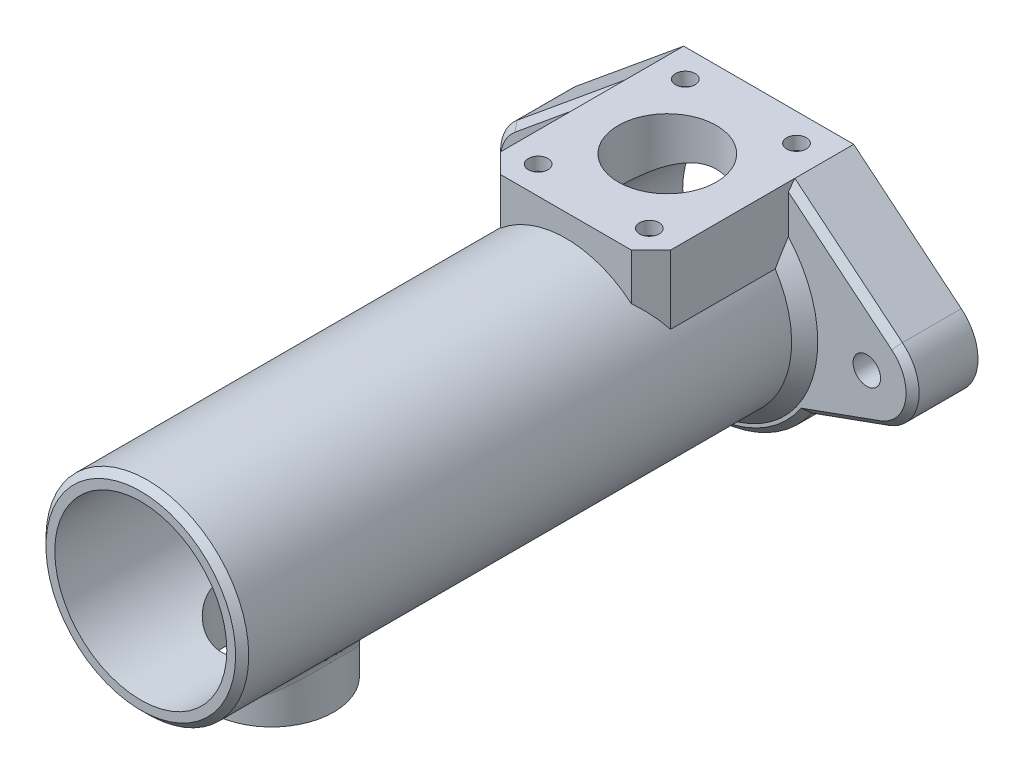
from build123d import *

# Parameters (mm, degrees)
SKIZZE1_R                       = 13.15
GRUNDK_RPER_DEPTH               = 96
SKIZZE11_R                      = 2.1
SKIZZE11_R_2                    = 13.15
AUFSATZ_LINEAR_AUSTRAGEN1_DEPTH = 10
FLANSCHTRICHTER_START           = -65
FLANSCHTRICHTER_DEPTH           = 65
SKIZZE7_R                       = 7.5
FUTTERAUSGANG_DEPTH             = 103.961157725
FUTTERAUSGANGROHR_REACH         = 110.427
FUTTERAUSGANGROHR_END_RADIUS    = 15.5
SKIZZE8_R                       = 9.5
SKIZZE8_R_2                     = 7.5
SKIZZE9_R                       = 7.5
SKIZZE9_R_2                     = 1.5
SCHRAUBENBOHRUNGEN_DEPTH        = 4
BOHRUNG_15MM_REACH              = 109.055
SKIZZE15_R                      = 7.5
BOHRUNG_15MM_DIRECTION_2_DEPTH  = 108.055460001
MUTTER_DEPTH                    = 2
FASE1_SIZE                      = 3
FASE2_SIZE                      = 2
VERRUNDUNG1_R                   = 2
FASE3_SIZE                      = 1
FASE4_SIZE                      = 1


with BuildPart() as part:
    # Skizze1 → Grundkörper (new body)
    with BuildSketch(Plane.XY):
        with BuildLine():
            Line((-13, 8.440971508), (-13, 18.940971508))
            Line((-13, 18.940971508), (13, 18.940971508))
            Line((13, 18.940971508), (13, 8.440971508))
            ThreePointArc((13, 8.440971508), (0, -15.5), (-13, 8.440971508))
        make_face()
        Circle(SKIZZE1_R, mode=Mode.SUBTRACT)
    extrude(amount=GRUNDK_RPER_DEPTH)

    # Skizze11 → Aufsatz-Linear austragen1 (add)
    with BuildSketch(Plane(origin=(0, 0, 0), x_dir=(-1, 0, 0), z_dir=(0, 0, -1))):
        with BuildLine():
            Line((13, 18.940971508), (29.448078949, 5.405052605))
            ThreePointArc((29.448078949, 5.405052605), (31.898107369, -1.190006186), (27.38, -6.582978049))
            Line((27.38, -6.582978049), (15.603987614, -10.840459887))
            ThreePointArc((15.603987614, -10.840459887), (0, -19), (-15.603987614, -10.840459887))
            Line((-15.603987614, -10.840459887), (-27.38, -6.582978049))
            ThreePointArc((-27.38, -6.582978049), (-31.898107369, -1.190006186), (-29.448078949, 5.405052605))
            Line((-29.448078949, 5.405052605), (-13, 18.940971508))
            Line((-13, 18.940971508), (13, 18.940971508))
        make_face()
        with Locations((25, 0)):
            Circle(SKIZZE11_R, mode=Mode.SUBTRACT)
        with Locations(Location((0, 0, 0), (0, 0, 180))):
            Circle(SKIZZE11_R_2, mode=Mode.SUBTRACT)
        with Locations((-25, 0)):
            Circle(SKIZZE11_R, mode=Mode.SUBTRACT)
    extrude(amount=-AUFSATZ_LINEAR_AUSTRAGEN1_DEPTH)

    # Skizze2 → FlanschTrichter (cut)
    with BuildSketch(Plane.XY.offset(96).offset(FLANSCHTRICHTER_START)):
        with BuildLine():
            Line((-13, 18.940971508), (13, 18.940971508))
            Line((13, 18.940971508), (13, 8.440971508))
            ThreePointArc((13, 8.440971508), (0, 15.5), (-13, 8.440971508))
            Line((-13, 8.440971508), (-13, 18.940971508))
        make_face()
    extrude(amount=FLANSCHTRICHTER_DEPTH, mode=Mode.SUBTRACT)

    # Skizze7 → FutterAusgang (cut, through all)
    with BuildSketch(Plane(origin=(0, 0, 0), x_dir=(1, 0, 0), z_dir=(0, 1, 0))):
        with Locations(Location((0, -76, 0), (0, 0, 270))):
            Circle(SKIZZE7_R)
    extrude(amount=-FUTTERAUSGANG_DEPTH, mode=Mode.SUBTRACT)

    # FutterAusgangRohr: up to this cylinder (the profile starts outside it)
    futterausgangrohr_end = Plane(origin=(0, 0, 85.231299), z_dir=(0, 0, -1)) * Cylinder(FUTTERAUSGANGROHR_END_RADIUS, 252.854, mode=Mode.PRIVATE)
    # Skizze8 → FutterAusgangRohr (add, up to the surface)
    with BuildSketch(Plane(origin=(0, -20, 0), x_dir=(1, 0, 0), z_dir=(0, 1, 0)), mode=Mode.PRIVATE) as futterausgangrohr_sk1:
        with Locations(Location((0, -76, 0), (0, 0, 90))):
            Circle(SKIZZE8_R)
        with Locations(Location((0, -76, 0), (0, 0, 270))):
            Circle(SKIZZE8_R_2, mode=Mode.SUBTRACT)
    futterausgangrohr_tool1 = extrude(futterausgangrohr_sk1.sketch, amount=FUTTERAUSGANGROHR_REACH, mode=Mode.PRIVATE) - futterausgangrohr_end
    add(futterausgangrohr_tool1.solids().sort_by_distance((0, -20, 85.231299))[0])

    # Skizze9 → Schraubenbohrungen (cut)
    with BuildSketch(Plane(origin=(0, 18.940971508, 0), x_dir=(1, 0, 0), z_dir=(0, 1, 0))):
        with Locations(Location((0, -15.5, 0), (0, 0, 270))):
            Circle(SKIZZE9_R)
        with Locations(Location((8.5, -4.25, 0), (0, 0, 270))):
            Circle(SKIZZE9_R_2)
        with Locations(Location((8.5, -26.75, 0), (0, 0, 270))):
            Circle(SKIZZE9_R_2)
        with Locations(Location((-8.5, -4.25, 0), (0, 0, 90))):
            Circle(SKIZZE9_R_2)
        with Locations(Location((-8.5, -26.75, 0), (0, 0, 90))):
            Circle(SKIZZE9_R_2)
    extrude(amount=-SCHRAUBENBOHRUNGEN_DEPTH, mode=Mode.SUBTRACT)

    # Skizze15 → Bohrung 15mm (cut, up to next)
    with BuildSketch(Plane(origin=(0, 14.940971508, 0), x_dir=(1, 0, 0), z_dir=(0, 1, 0)), mode=Mode.PRIVATE) as bohrung_15mm_sk1:
        with Locations(Location((0, -15.5, 0), (0, 0, 270))):
            Circle(SKIZZE15_R)
    bohrung_15mm_tool1 = extrude(bohrung_15mm_sk1.sketch, amount=-BOHRUNG_15MM_REACH, mode=Mode.PRIVATE) & part.part
    add(bohrung_15mm_tool1.solids().sort_by_distance((0, 14.940972, 15.5))[0], mode=Mode.SUBTRACT)

    # Skizze15 → Bohrung 15mm direction 2 (cut)
    with BuildSketch(Plane(origin=(0, 14.940971508, 0), x_dir=(1, 0, 0), z_dir=(0, 1, 0))):
        with Locations(Location((0, -15.5, 0), (0, 0, 270))):
            Circle(SKIZZE15_R)
    extrude(amount=BOHRUNG_15MM_DIRECTION_2_DEPTH, mode=Mode.SUBTRACT)

    # Skizze14 → Mutter (add)
    with BuildSketch(Plane(origin=(0, 14.940971508, 0), x_dir=(1, 0, 0), z_dir=(0, 1, 0))):
        Polygon((6.355666899, -7.964164986), (10.644394681, -7.964129433), (12.788727782, -4.249964446), (10.644333101, -0.535835014), (6.355605319, -0.535870567), (4.211272218, -4.250035554), align=None)
        Polygon((-6.355605319, -0.535870567), (-4.211272218, -4.250035554), (-6.355666899, -7.964164986), (-10.644394681, -7.964129433), (-12.788727782, -4.249964446), (-10.644333101, -0.535835014), align=None)
        Polygon((6.355666899, -23.035835014), (10.644394681, -23.035870567), (12.788727782, -26.750035554), (10.644333101, -30.464164986), (6.355605319, -30.464129433), (4.211272218, -26.749964446), align=None)
        Polygon((-12.788727782, -26.750035554), (-10.644333101, -30.464164986), (-6.355605319, -30.464129433), (-4.211272218, -26.749964446), (-6.355666899, -23.035835014), (-10.644394681, -23.035870567), align=None)
    extrude(amount=MUTTER_DEPTH)

    # Fase1
    # the kernel refuses this chamfer: 3 mm, written as the material it takes off along each edge
    with BuildSketch(Plane(origin=(-13, 0.725922544, 31), x_dir=(-0.02749587661058619, 0, -0.9996219169112968), z_dir=(0, 1, 0))) as fase1_piece_1_section:
        Polygon((FASE1_SIZE * 0.999621916911, -FASE1_SIZE * 0.0274958766106), (-FASE1_SIZE * 0.0274958766106, -FASE1_SIZE * 0.999621916911), (0, 0), align=None)
    fase1_piece_1 = extrude(amount=25.930097928, mode=Mode.PRIVATE)
    fase1_piece_1 = fase1_piece_1 - Plane(origin=(0, 0, 29.989054499), x_dir=(0.8387096774193548, 0.5445788069720691, 0), z_dir=(0, 0, -1)) * Cylinder(15.5, 64, mode=Mode.PRIVATE)
    add(fase1_piece_1, mode=Mode.SUBTRACT)
    with BuildSketch(Plane(origin=(13, 26.656020472, 31), x_dir=(0.02749587661058619, 0, -0.9996219169112968), z_dir=(0, -1, 0))) as fase1_piece_2_section:
        Polygon((FASE1_SIZE * 0.999621916911, -FASE1_SIZE * 0.0274958766106), (-FASE1_SIZE * 0.0274958766106, -FASE1_SIZE * 0.999621916911), (0, 0), align=None)
    fase1_piece_2 = extrude(amount=25.930097928, mode=Mode.PRIVATE)
    fase1_piece_2 = fase1_piece_2 - Plane(origin=(0, 0, 29.989054504), x_dir=(0.8387096774193548, 0.5445788069720691, 0), z_dir=(0, 0, -1)) * Cylinder(15.5, 64, mode=Mode.PRIVATE)
    add(fase1_piece_2, mode=Mode.SUBTRACT)

    # Fase2
    fase2_edges = [part.edges().sort_by_distance(p)[0] for p in [
        (0, -15.5, 10),
    ]]
    chamfer(fase2_edges, length=FASE2_SIZE)

    # Verrundung1
    verrundung1_edges = [part.edges().sort_by_distance(p)[0] for p in [
        (-1e-09, -15.500000004, 85.500000003),
    ]]
    fillet(verrundung1_edges, radius=VERRUNDUNG1_R)

    # Fase3
    fase3_edges = [part.edges().sort_by_distance(p)[0] for p in [
        (-21.224039475, 12.173012057, 10),
        (21.491993807, -8.711718968, 10),
        (31.898107369, -1.190006186, 10),
        (-31.898107369, -1.190006186, 10),
        (-21.491993807, -8.711718968, 10),
        (0, -19, 10),
        (21.224039475, 12.173012057, 10),
    ]]
    chamfer(fase3_edges, length=FASE3_SIZE)

    # Fase4
    fase4_edges = [part.edges().sort_by_distance(p)[0] for p in [
        (-13, -8.440971508, 96),
    ]]
    chamfer(fase4_edges, length=FASE4_SIZE)


solid = part.part
